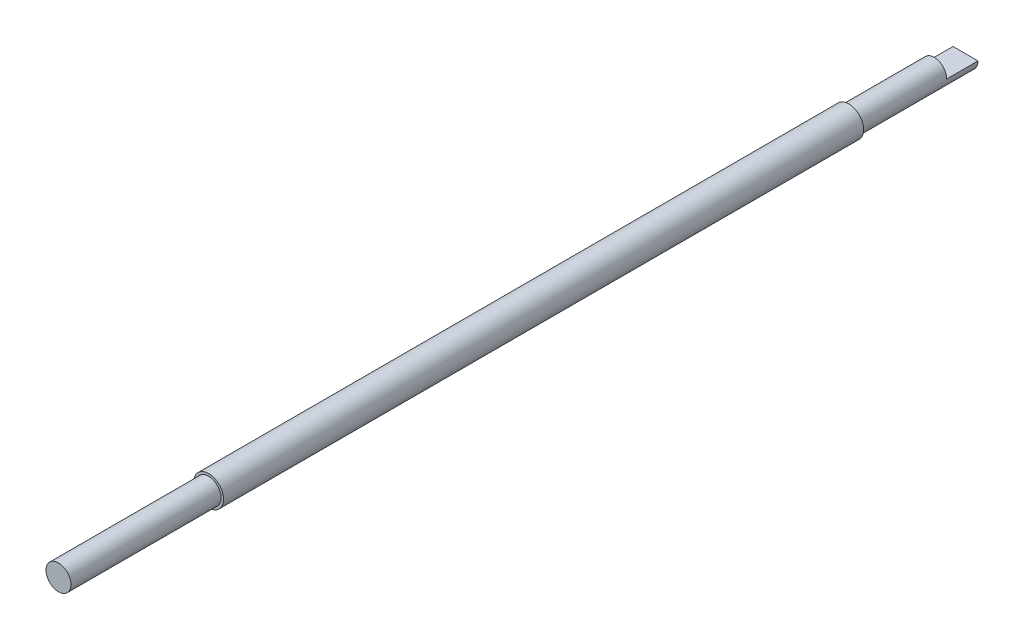
from build123d import *

# Parameters (mm, degrees)
SKETCH1_R           = 4.7625
BOSS_EXTRUDE1_DEPTH = 290
SKETCH3_R           = 4.7625
SKETCH3_R_2         = 4
CUT_EXTRUDE2_DEPTH  = 37.32
CUT_EXTRUDE3_DEPTH  = 10
CUT_EXTRUDE4_START  = -48
SKETCH5_R           = 4.7625
SKETCH5_R_2         = 4
CUT_EXTRUDE4_DEPTH  = 48


with BuildPart() as part:
    # Sketch1 → Boss-Extrude1 (new body)
    with BuildSketch(Plane.XY):
        Circle(SKETCH1_R)
    extrude(amount=BOSS_EXTRUDE1_DEPTH)

    # Sketch3 → Cut-Extrude2 (cut)
    with BuildSketch(Plane(origin=(0, 0, 0), x_dir=(-1, 0, 0), z_dir=(0, 0, -1))):
        Circle(SKETCH3_R)
        Circle(SKETCH3_R_2, mode=Mode.SUBTRACT)
    extrude(amount=-CUT_EXTRUDE2_DEPTH, mode=Mode.SUBTRACT)

    # Sketch4 → Cut-Extrude3 (cut)
    with BuildSketch(Plane(origin=(0, 0, 0), x_dir=(-1, 0, 0), z_dir=(0, 0, -1))):
        with BuildLine():
            ThreePointArc((4, 0), (0, 4), (-4, 0))
            Line((-4, 0), (4, 0))
        make_face()
    extrude(amount=-CUT_EXTRUDE3_DEPTH, mode=Mode.SUBTRACT)

    # Sketch5 → Cut-Extrude4 (cut)
    with BuildSketch(Plane.XY.offset(290).offset(CUT_EXTRUDE4_START)):
        Circle(SKETCH5_R)
        Circle(SKETCH5_R_2, mode=Mode.SUBTRACT)
    extrude(amount=CUT_EXTRUDE4_DEPTH, mode=Mode.SUBTRACT)


solid = part.part
